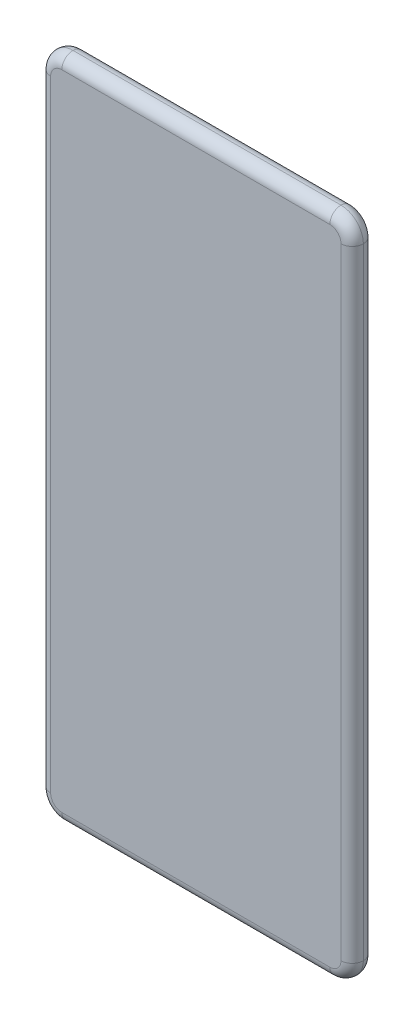
from build123d import *

# Parameters (mm, degrees)
BOSS_EXTRUDE1_DEPTH = 100
FILLET1_R           = 50


with BuildPart() as part:
    # Sketch1 → Boss-Extrude1 (new body)
    with BuildSketch(Plane.XY):
        with BuildLine():
            Line((-1300, -19), (-100, -19))
            ThreePointArc((-100, -19), (-29.289321881, -48.289321881), (0, -119))
            Line((0, -119), (0, -2899))
            ThreePointArc((0, -2899), (-29.289321881, -2969.710678119), (-100, -2999))
            Line((-100, -2999), (-1300, -2999))
            ThreePointArc((-1300, -2999), (-1370.710678119, -2969.710678119), (-1400, -2899))
            Line((-1400, -2899), (-1400, -119))
            ThreePointArc((-1400, -119), (-1370.710678119, -48.289321881), (-1300, -19))
        make_face()
    extrude(amount=BOSS_EXTRUDE1_DEPTH)

    # Fillet1
    fillet1_edges = [part.edges().sort_by_distance(p)[0] for p in [
        (-1370.710678119, -2969.710678119, 0),
        (-700, -2999, 0),
        (-29.289321881, -2969.710678119, 0),
        (0, -1509, 0),
        (-29.289321881, -48.289321881, 0),
        (-700, -19, 0),
        (-1370.710678119, -48.289321881, 0),
        (-1400, -1509, 0),
        (-1370.710678119, -2969.710678119, 100),
        (-700, -2999, 100),
        (-29.289321881, -2969.710678119, 100),
        (0, -1509, 100),
        (-29.289321881, -48.289321881, 100),
        (-700, -19, 100),
        (-1370.710678119, -48.289321881, 100),
        (-1400, -1509, 100),
    ]]
    fillet(fillet1_edges, radius=FILLET1_R - 0.0001)  # a hair under: the kernel refuses the full size


solid = part.part
